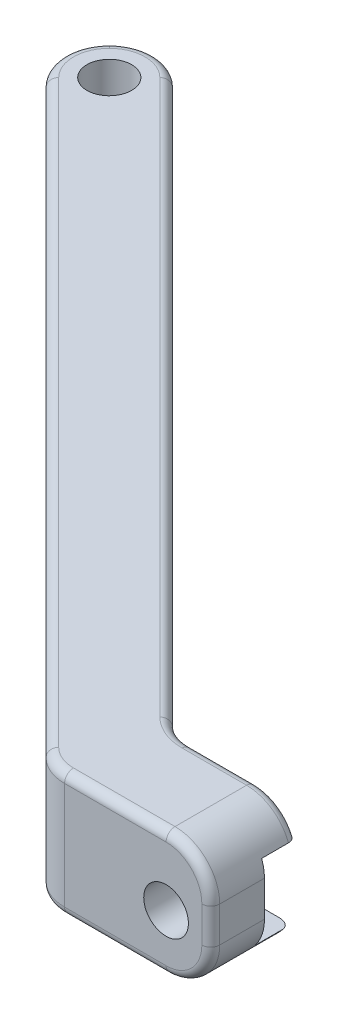
from build123d import *

# Parameters (mm, degrees)
SKETCH1_R           = 2.5
BOSS_EXTRUDE1_DEPTH = 13.97
CUT_EXTRUDE1_REACH  = 108.146
SKETCH2_R           = 2.5
FILLET1_R           = 5
FILLET2_R           = 1
SKETCH3_R           = 2.5
CUT_EXTRUDE2_DEPTH  = 4


with BuildPart() as part:
    # Sketch1 → Boss-Extrude1 (new body)
    with BuildSketch(Plane(origin=(0, 0, 0), x_dir=(1, 0, 0), z_dir=(0, 1, 0))):
        Polygon((0, 7.071067812), (-7.071067812, 0), (62.778932188, -69.85), (81.2, -69.85), (81.2, -59.85), (66.921067812, -59.85), align=None)
        with Locations(Location((0, 0, 0), (0, 0, 270))):
            Circle(SKETCH1_R, mode=Mode.SUBTRACT)
    extrude(amount=BOSS_EXTRUDE1_DEPTH)

    # Sketch2 → Cut-Extrude1 (cut, up to next)
    with BuildSketch(Plane(origin=(0, 0, 59.85), x_dir=(-1, 0, 0), z_dir=(0, 0, -1)), mode=Mode.PRIVATE) as cut_extrude1_sk1:
        with Locations((-76.2, 6.35)):
            Circle(SKETCH2_R)
    cut_extrude1_tool1 = extrude(cut_extrude1_sk1.sketch, amount=-CUT_EXTRUDE1_REACH, mode=Mode.PRIVATE) & part.part
    add(cut_extrude1_tool1.solids().sort_by_distance((76.2, 6.35, 59.85))[0], mode=Mode.SUBTRACT)

    # Fillet1
    fillet1_edges = [part.edges().sort_by_distance(p)[0] for p in [
        (-7.071067812, 6.985, 0),
        (0, 6.985, -7.071067812),
        (81.2, 0, 64.85),
        (81.2, 13.97, 64.85),
        (62.778932188, 6.985, 69.85),
        (66.921067812, 6.985, 59.85),
    ]]
    fillet(fillet1_edges, radius=FILLET1_R - 0.0001)  # a hair under: the kernel refuses the full size

    # Fillet2
    fillet2_edges = [part.edges().sort_by_distance(p)[0] for p in [
        (28.889445383, 0, 35.960513195),
        (28.889445383, 13.97, 35.960513195),
        (70.525029289, 0, 69.85),
        (34.496047101, 0, 27.424979289),
        (72.596097101, 0, 59.85),
        (62.936579685, 0, 69.469405275),
        (0, 0, -5.000041421),
        (-5.000041421, 0, 0),
        (72.596097101, 13.97, 59.85),
        (34.496047101, 13.97, 27.424979289),
        (70.525029289, 13.97, 69.85),
        (62.936579685, 13.97, 69.469405275),
        (0, 13.97, -5.000041421),
        (-5.000041421, 13.97, 0),
        (81.2, 6.985, 59.85),
        (81.2, 6.985, 69.85),
        (79.735563195, 12.505563195, 59.85),
        (79.735563195, 1.464436805, 59.85),
        (79.735563195, 12.505563195, 69.85),
        (79.735563195, 1.464436805, 69.85),
        (67.078715309, 0, 59.469405275),
        (67.078715309, 13.97, 59.469405275),
    ]]
    fillet(fillet2_edges, radius=FILLET2_R)

    # Sketch3 → Cut-Extrude2 (cut)
    # profile 1 of 5: a face of its own
    with BuildSketch(Plane(origin=(0, 0, 59.85), x_dir=(-1, 0, 0), z_dir=(0, 0, -1))):
        with BuildLine():
            Line((-80.164228202, 4.466244658), (-78.725907428, 1.975))
            Line((-78.725907428, 1.975), (-73.674092572, 1.975))
            Line((-73.674092572, 1.975), (-71.148185145, 6.35))
            Line((-71.148185145, 6.35), (-73.674092572, 10.725))
            Line((-73.674092572, 10.725), (-78.725907428, 10.725))
            Line((-78.725907428, 10.725), (-80.2, 8.17179677))
            Line((-80.2, 8.17179677), (-80.2, 5))
            ThreePointArc((-80.2, 5), (-80.191047031, 4.732523652), (-80.164228202, 4.466244658))
        make_face()
        with Locations((-76.2, 6.35)):
            Circle(SKETCH3_R, mode=Mode.SUBTRACT)
    # profile 2 of 5: a face of its own
    with BuildSketch(Plane(origin=(0, 0, 59.85), x_dir=(-1, 0, 0), z_dir=(0, 0, -1))):
        with BuildLine():
            Line((-82.608963745, 1.975), (-78.817131063, 1.975))
            ThreePointArc((-78.817131063, 1.975), (-79.718543367, 3.097408985), (-80.164228202, 4.466244658))
            Line((-80.164228202, 4.466244658), (-81.251814855, 6.35))
            Line((-81.251814855, 6.35), (-80.2, 8.17179677))
            Line((-80.2, 8.17179677), (-80.2, 8.97))
            ThreePointArc((-80.2, 8.97), (-80.097290514, 9.870625701), (-79.794436674, 10.725))
            Line((-79.794436674, 10.725), (-82.608963745, 10.725))
            Line((-82.608963745, 10.725), (-82.608963745, 1.975))
        make_face()
    # profile 3 of 5: a face of its own
    with BuildSketch(Plane(origin=(0, 0, 59.85), x_dir=(-1, 0, 0), z_dir=(0, 0, -1))):
        with BuildLine():
            Line((-81.251814855, 6.35), (-80.164228202, 4.466244658))
            ThreePointArc((-80.164228202, 4.466244658), (-80.191047031, 4.732523652), (-80.2, 5))
            Line((-80.2, 5), (-80.2, 8.17179677))
            Line((-80.2, 8.17179677), (-81.251814855, 6.35))
        make_face()
    # profile 4 of 5: a face of its own
    with BuildSketch(Plane(origin=(0, 0, 59.85), x_dir=(-1, 0, 0), z_dir=(0, 0, -1))):
        with BuildLine():
            Line((-80.2, 8.97), (-80.2, 8.17179677))
            Line((-80.2, 8.17179677), (-78.725907428, 10.725))
            Line((-78.725907428, 10.725), (-79.794436674, 10.725))
            ThreePointArc((-79.794436674, 10.725), (-80.097290514, 9.870625701), (-80.2, 8.97))
        make_face()
    # profile 5 of 5: a face of its own
    with BuildSketch(Plane(origin=(0, 0, 59.85), x_dir=(-1, 0, 0), z_dir=(0, 0, -1))):
        with BuildLine():
            Line((-78.817131063, 1.975), (-78.725907428, 1.975))
            Line((-78.725907428, 1.975), (-80.164228202, 4.466244658))
            ThreePointArc((-80.164228202, 4.466244658), (-79.718543367, 3.097408985), (-78.817131063, 1.975))
        make_face()
    extrude(amount=-CUT_EXTRUDE2_DEPTH, mode=Mode.SUBTRACT)


solid = part.part
